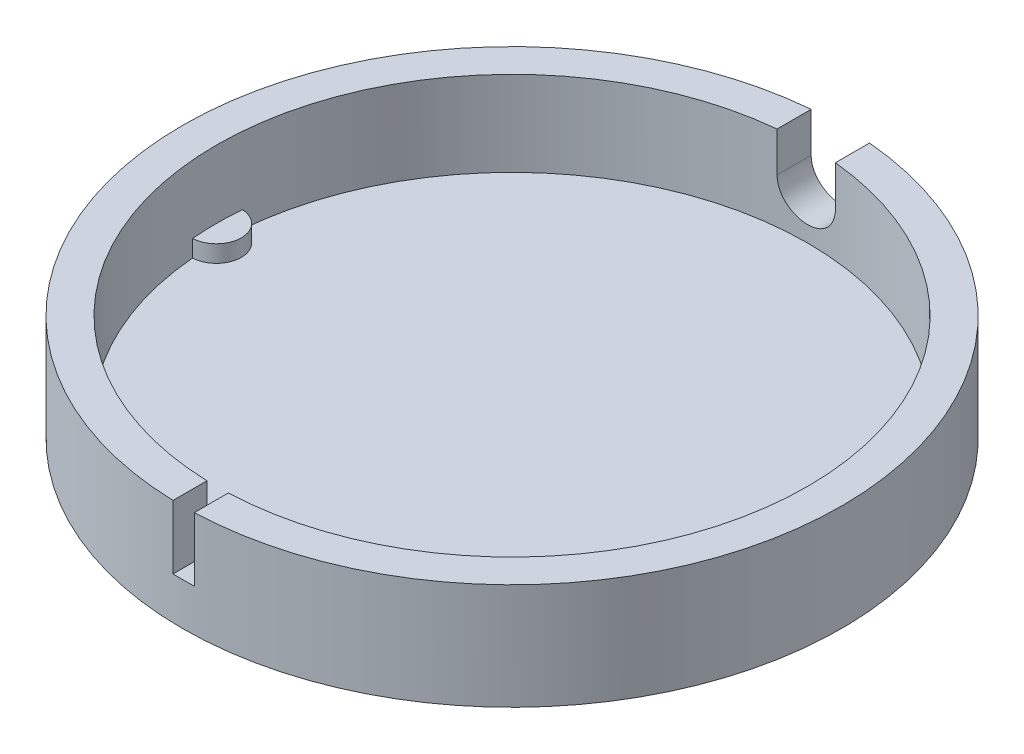
from build123d import *

# Parameters (mm, degrees)
SKETCH1_R           = 31.06
BOSS_EXTRUDE1_DEPTH = 10
SKETCH2_R           = 27.86
CUT_EXTRUDE1_DEPTH  = 8
BOSS_EXTRUDE2_START = 1.6
BOSS_EXTRUDE2_DEPTH = 1.6
CUT_EXTRUDE2_DEPTH  = 46.049386233
SKETCH5_W           = 2
SKETCH5_H           = 6.000963959
CUT_EXTRUDE3_DEPTH  = 46.049386417


with BuildPart() as part:
    # Sketch1 → Boss-Extrude1 (new body)
    with BuildSketch(Plane(origin=(0, 0, 0), x_dir=(1, 0, 0), z_dir=(0, 1, 0))):
        Circle(SKETCH1_R)
    extrude(amount=BOSS_EXTRUDE1_DEPTH)

    # Sketch2 → Cut-Extrude1 (cut)
    with BuildSketch(Plane(origin=(0, 10, 0), x_dir=(1, 0, 0), z_dir=(0, 1, 0))):
        Circle(SKETCH2_R)
    extrude(amount=-CUT_EXTRUDE1_DEPTH, mode=Mode.SUBTRACT)

    # Sketch3 → Boss-Extrude2 (add)
    with BuildSketch(Plane(origin=(0, 2, 0), x_dir=(1, 0, 0), z_dir=(0, 1, 0)).offset(BOSS_EXTRUDE2_START)):
        with BuildLine():
            ThreePointArc((-27.76088837, -2.347909045), (-25.51, 0), (-27.76088837, 2.347909045))
            ThreePointArc((-27.76088837, 2.347909045), (-27.86, 0), (-27.76088837, -2.347909045))
        make_face()
        with BuildLine():
            ThreePointArc((27.76088837, 2.347909045), (25.51, 0), (27.76088837, -2.347909045))
            ThreePointArc((27.76088837, -2.347909045), (27.86, 0), (27.76088837, 2.347909045))
        make_face()
    extrude(amount=-BOSS_EXTRUDE2_DEPTH)

    # Sketch4 → Cut-Extrude2 (cut, through all)
    with BuildSketch(Plane.XY):
        with BuildLine():
            Line((2.75, 6.25), (2.75, 10))
            Line((2.75, 10), (-2.75, 10))
            Line((-2.75, 10), (-2.75, 6.25))
            ThreePointArc((-2.75, 6.25), (-1.944543648, 4.305456352), (0, 3.5))
            ThreePointArc((0, 3.5), (1.944543648, 4.305456352), (2.75, 6.25))
        make_face()
    extrude(amount=-CUT_EXTRUDE2_DEPTH, mode=Mode.SUBTRACT)

    # Sketch5 → Cut-Extrude3 (cut, through all)
    with BuildSketch(Plane.XY):
        with Locations((0.098176677, 6.999518021)):
            Rectangle(SKETCH5_W, SKETCH5_H)
    extrude(amount=CUT_EXTRUDE3_DEPTH, mode=Mode.SUBTRACT)


solid = part.part
